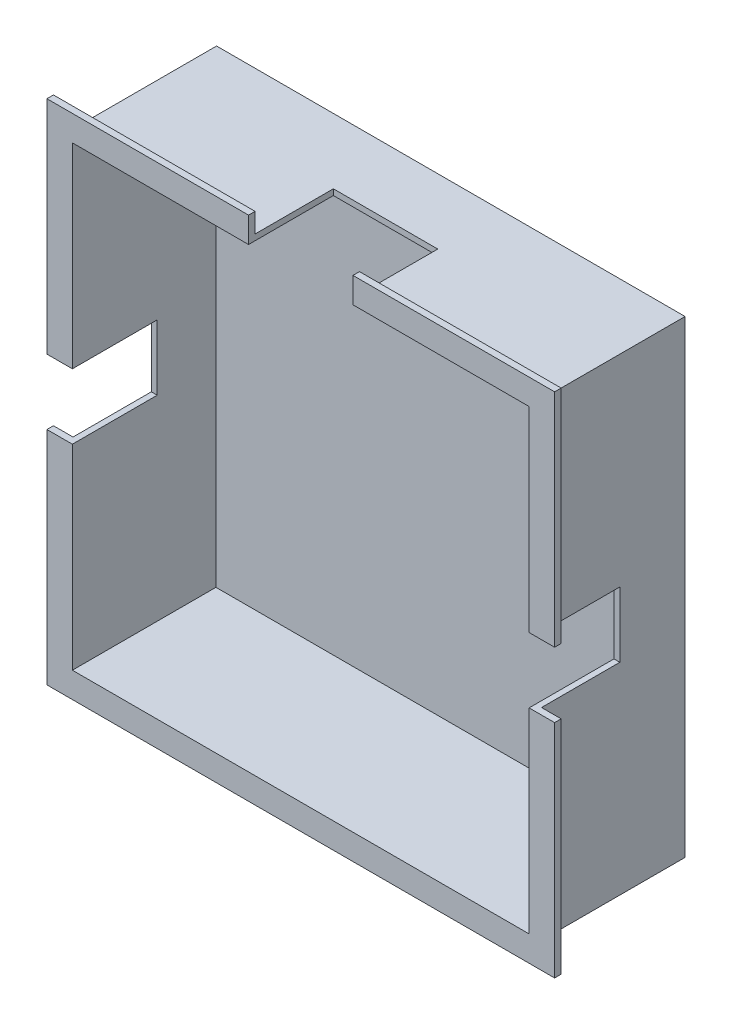
from build123d import *

# Parameters (mm, degrees)
BOSS_EXTRUDE2_DEPTH   = 23
BOSS_EXTRUDE2_2_DEPTH = 23
BOSS_EXTRUDE2_3_DEPTH = 23
SKETCH2_W             = 70
SKETCH2_H             = 1
BOSS_EXTRUDE3_DEPTH   = 70
SKETCH1_5_W           = 0.9
SKETCH1_5_H           = 10
SKETCH1_5_W_2         = 16
SKETCH1_5_H_2         = 0.9
BOSS_EXTRUDE4_DEPTH   = 10
BOSS_EXTRUDE5_DEPTH   = 1


with BuildPart() as part:
    # Sketch1 → Boss-Extrude2 (new body)
    with BuildSketch(Plane.XY):
        Polygon((-0.9, 30), (-0.9, -0.9), (70.9, -0.9), (70.9, 30), (70, 30), (70, 0), (0, 0), (0, 30), align=None)
    extrude(amount=BOSS_EXTRUDE2_DEPTH)



with BuildPart() as body_2:
    # Sketch1 → Boss-Extrude2 2 (new body)
    with BuildSketch(Plane.XY):
        Polygon((0, 40), (0, 70), (27, 70), (27, 70.9), (-0.9, 70.9), (-0.9, 40), align=None)
    extrude(amount=BOSS_EXTRUDE2_2_DEPTH)


with BuildPart() as body_3:
    # Sketch1 → Boss-Extrude2 3 (new body)
    with BuildSketch(Plane.XY):
        Polygon((70, 70), (70, 40), (70.9, 40), (70.9, 70.9), (43, 70.9), (43, 70), align=None)
    extrude(amount=BOSS_EXTRUDE2_3_DEPTH)


with BuildPart() as part_1:
    add(part.part)

    add(body_2.part)  # Boss-Extrude3 merges body 2

    add(body_3.part)  # Boss-Extrude3 merges body 3
    # Sketch2 → Boss-Extrude3 (add)
    with BuildSketch(Plane(origin=(0, 0, 0), x_dir=(1, 0, 0), z_dir=(0, 1, 0))):
        with Locations((35, -0.5)):
            Rectangle(SKETCH2_W, SKETCH2_H)
    extrude(amount=BOSS_EXTRUDE3_DEPTH)

    # Sketch1<5> → Boss-Extrude4 (add)
    with BuildSketch(Plane.XY):
        with Locations((-0.45, 35)):
            Rectangle(SKETCH1_5_W, SKETCH1_5_H)
        with Locations((70.45, 35)):
            Rectangle(SKETCH1_5_W, SKETCH1_5_H)
        with Locations((35, 70.45)):
            Rectangle(SKETCH1_5_W_2, SKETCH1_5_H_2)
    extrude(amount=BOSS_EXTRUDE4_DEPTH)

    # Sketch4 → Boss-Extrude5 (add)
    with BuildSketch(Plane.XY.offset(23)):
        Polygon((27, 73.904290744), (-3.9, 73.904290744), (-3.9, 40), (-0.9, 40), (-0.9, 70.9), (27, 70.9), align=None)
        Polygon((73.904290744, 73.904290744), (43, 73.904290744), (43, 70.9), (70.9, 70.9), (70.9, 40), (73.904290744, 40), align=None)
        Polygon((-0.9, 30), (-3.9, 30), (-3.9, -3.9), (73.904290744, -3.9), (73.904290744, 30), (70.9, 30), (70.9, -0.9), (-0.9, -0.9), align=None)
    extrude(amount=-BOSS_EXTRUDE5_DEPTH)


solid = part_1.part
